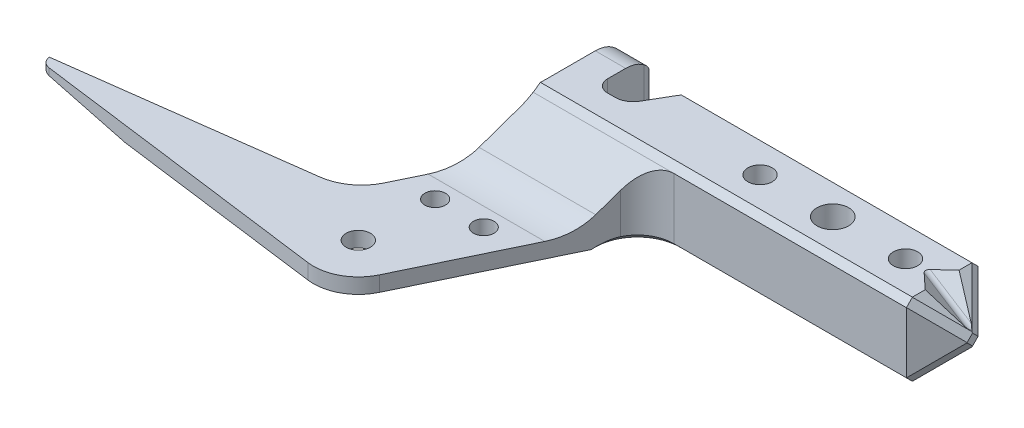
from build123d import *

# Parameters (mm, degrees)
BOSS_EXTRUDE1_DEPTH          = 2.5
BOSS_EXTRUDE2_DEPTH          = 12
F_4_0_4_DIAMETER_HOLE1_D     = 4
F_4_0_4_DIAMETER_HOLE2_D     = 4
F_5_2_5_2_DIAMETER_HOLE1_D   = 5.2
CHAMFER5_SIZE                = 8.5
FILLET13_R                   = 6
CHAMFER1_SIZE                = 5
CHAMFER2_SIZE                = 1
CHAMFER4_SIZE                = 0.8
CUT_REVOLVE1_ANGLE           = 60
CUT_REVOLVE1_OTHER_WAY_ANGLE = 60
FILLET4_R                    = 1
FILLET5_R                    = 8
FILLET6_R                    = 3
FILLET7_R                    = 2
FILLET11_R                   = 5
FILLET12_R                   = 2
CUT_EXTRUDE2_DEPTH           = 38
CHAMFER8_SIZE                = 6.868693549
CHAMFER8_SIZE_2              = 2.5
FILLET14_R                   = 3
M3_CLEARANCE_HOLE1_D         = 3.4


with BuildPart() as part:
    # Sketch1 → Boss-Extrude1 (new body)
    with BuildSketch(Plane(origin=(0, 0, 0), x_dir=(1, 0, 0), z_dir=(0, 1, 0))):
        with BuildLine():
            Line((-7.904447763, 6.416984589), (-51.546411114, 0.671411114))
            ThreePointArc((-51.546411114, 0.671411114), (-51.035673477, -0.364262362), (-50, -0.875))
            Line((-50, -0.875), (-0.965087675, -7.330568677))
            ThreePointArc((-0.965087675, -7.330568677), (3.516208172, -6.504222585), (6.661937904, -3.207368814))
            Line((6.661937904, -3.207368814), (21.2, 26.989241728))
            Line((21.2, 26.989241728), (2, 26.989241728))
            Line((2, 26.989241728), (-7.904447763, 6.416984589))
        make_face()
    extrude(amount=BOSS_EXTRUDE1_DEPTH)

    # Sketch1<6> → Boss-Extrude2 (add)
    with BuildSketch(Plane(origin=(0, 0, 0), x_dir=(1, 0, 0), z_dir=(0, 1, 0))):
        Polygon((2, 42), (2, 26.989241728), (68.2, 26.989241728), (68.2, 38.789241728), (15.919770539, 38.789241728), (12, 32), (7, 32), (7, 42), align=None)
    extrude(amount=BOSS_EXTRUDE2_DEPTH)

    # Ø4.0 (4) Diameter Hole1 (through all)
    with Locations(Plane(origin=(0, 0, 0), x_dir=(-1, 0, 0), z_dir=(0, -1, 0))):
        with Locations((-57.170705016, 32.889241728), (-33.229294984, 32.889241728)):
            Hole(F_4_0_4_DIAMETER_HOLE1_D / 2)

    # Ø4.0 (4) Diameter Hole2 (through all)
    with Locations(Plane(origin=(0, 0, 0), x_dir=(-1, 0, 0), z_dir=(0, -1, 0))):
        with Locations((0, 0)):
            Hole(F_4_0_4_DIAMETER_HOLE2_D / 2)

    # Ø5.2 (5.2) Diameter Hole1 (through all)
    with Locations(Plane(origin=(0, 0, 0), x_dir=(-1, 0, 0), z_dir=(0, -1, 0))):
        with Locations((-45.2, 32.889241728)):
            Hole(F_5_2_5_2_DIAMETER_HOLE1_D / 2)

    # Chamfer5
    chamfer5_edges = [part.edges().sort_by_distance(p)[0] for p in [
        (11.6, 2.5, -26.989241728),
    ]]
    chamfer(chamfer5_edges, length=CHAMFER5_SIZE)

    # Fillet13
    fillet13_edges = [part.edges().sort_by_distance(p)[0] for p in [
        (21.2, 5.5, -26.989241728),
    ]]
    fillet(fillet13_edges, radius=FILLET13_R)

    # Chamfer1
    chamfer1_edges = [part.edges().sort_by_distance(p)[0] for p in [
        (68.2, 0, -32.889241728),
        (68.2, 6, -26.989241728),
        (68.2, 6, -38.789241728),
        (68.2, 12, -32.889241728),
    ]]
    chamfer(chamfer1_edges, length=CHAMFER1_SIZE)

    # Chamfer2
    # the kernel refuses this chamfer: 1 mm, written as the material it takes off along each edge
    with BuildSketch(Plane(origin=(24.970484005, 0, -26.989241728), x_dir=(0, 0, -1), z_dir=(1, 0, 0))) as chamfer2_piece_1:
        Polygon((CHAMFER2_SIZE, 0), (0, CHAMFER2_SIZE), (0, 0), align=None)
    extrude(amount=40.801198983, mode=Mode.SUBTRACT)
    with BuildSketch(Plane(origin=(-0.571682988, 12, -26.989241728), x_dir=(0, -1, 0), z_dir=(1, 0, 0))) as chamfer2_piece_2:
        Polygon((CHAMFER2_SIZE, 0), (0, CHAMFER2_SIZE), (0, 0), align=None)
    extrude(amount=66.343365976, mode=Mode.SUBTRACT)
    with BuildSketch(Plane(origin=(65.771682988, 12, -38.789241728), x_dir=(0, -1, 0), z_dir=(-1, 0, 0)), Plane(origin=(65.771682988, 0, -38.789241728), x_dir=(0, 0, 1), z_dir=(-1, 0, 0))) as chamfer2_piece_3:
        Polygon((CHAMFER2_SIZE, 0), (0, CHAMFER2_SIZE), (0, 0), align=None)
    extrude(amount=52.423595437, mode=Mode.SUBTRACT)
    with BuildSketch(Plane(origin=(24.970484005, 0, -20.989241728), x_dir=(-0.9610284466527214, -1.1097335043339142e-15, 0.27644949760174536), z_dir=(0.27644949760174536, 0, 0.9610284466527214))) as chamfer2_piece_4:
        Polygon((6 + CHAMFER2_SIZE, 0), (6, -CHAMFER2_SIZE), (6, 0), align=None)
    revolve(axis=Axis((24.970484005, 0, -20.989241728), (0, -1, 0)), revolution_arc=106.048413393, mode=Mode.SUBTRACT)

    # Chamfer4
    # the kernel refuses this chamfer: 0.8 mm, written as the material it takes off along each edge
    with BuildSketch(Plane(origin=(62.505076275, -0.694923725, -39.484165453), x_dir=(-0.40824829046386635, -0.4082482904638597, 0.816496580927726), z_dir=(0.5773502691896258, 0.5773502691896258, 0.5773502691896258)), Plane(origin=(62.505076275, 12.694923725, -39.484165453), x_dir=(-0.40824829046386746, -0.816496580927726, -0.4082482904638586), z_dir=(0.5773502691896258, -0.5773502691896258, 0.5773502691896258)), Plane(origin=(69.394923725, 5.805076275, -33.184165453), x_dir=(-0.408248290463863, -0.816496580927726, 0.408248290463863), z_dir=(-0.5773502691896258, 0.5773502691896258, 0.5773502691896258))) as chamfer4_piece_1:
        Polygon((CHAMFER4_SIZE, 0), (-CHAMFER4_SIZE * 0.5, -CHAMFER4_SIZE * 0.866025403784), (0, 0), align=None)
    extrude(amount=11.933565841, mode=Mode.SUBTRACT)
    with BuildSketch(Plane(origin=(62.505076275, -0.694923725, -26.294318002), x_dir=(-0.4082482904638641, -0.4082482904638619, -0.816496580927726), z_dir=(0.5773502691896258, 0.5773502691896258, -0.5773502691896258))) as chamfer4_piece_2:
        Polygon((CHAMFER4_SIZE, 0), (-CHAMFER4_SIZE * 0.5, CHAMFER4_SIZE * 0.866025403784), (0, 0), align=None)
    extrude(amount=11.933565841, mode=Mode.SUBTRACT)

    # Sketch7 → Cut-Revolve1 (revolve, cut)
    with BuildSketch(Plane.XY.offset(-32.889241728)):
        Polygon((68.2, 6.920204103), (60.2, 12), (60.2, 14), (68.2, 14), align=None)
    revolve(axis=Axis((68.2, 6.920204103, -32.889241728), (-0.8441922430161829, 0.5360405365560577, 0)), revolution_arc=CUT_REVOLVE1_ANGLE, mode=Mode.SUBTRACT)

    # Sketch7 → Cut-Revolve1 other way (revolve, cut)
    with BuildSketch(Plane.XY.offset(-32.889241728)):
        Polygon((68.2, 6.920204103), (60.2, 12), (60.2, 14), (68.2, 14), align=None)
    revolve(axis=Axis((68.2, 6.920204103, -32.889241728), (0.8441922430161829, -0.5360405365560577, 0)), revolution_arc=CUT_REVOLVE1_OTHER_WAY_ANGLE, mode=Mode.SUBTRACT)

    # Fillet4
    # the kernel refuses this fillet: 1 mm, written as the material it adds along each edge
    with BuildSketch(Plane(origin=(69.418486547, 6.146496233, -32.889241728), x_dir=(0.26802026827802927, 0.42209612150809256, -0.8660254037844378), z_dir=(-0.8441922430161831, 0.5360405365560573, 0))) as fillet4_piece_1_section:
        with BuildLine():
            CenterArc((FILLET4_R * 0.57735026919, -FILLET4_R), FILLET4_R, 90, 60)
            Line((-FILLET4_R * 0.288675134595, -FILLET4_R * 0.5), (0, 0))
            Line((0, 0), (FILLET4_R * 0.57735026919, 0))
        make_face()
    fillet4_piece_1 = extrude(amount=12.363265808, mode=Mode.PRIVATE)
    fillet4_piece_1 = split(fillet4_piece_1, bisect_by=Plane(origin=(69.418486547, 12, -32.889241728), z_dir=(0, -1, 0)), keep=Keep.TOP, mode=Mode.PRIVATE)
    fillet4_piece_1 = split(fillet4_piece_1, bisect_by=Plane(origin=(68.864064806, 5.869285362, -33.166452598), z_dir=(-0.8164965809277263, -0.4082482904637079, -0.4082482904640183)), keep=Keep.TOP, mode=Mode.PRIVATE)
    fillet4_piece_1 = split(fillet4_piece_1, bisect_by=Plane(origin=(69.235995157, 5.964004843, -32.889241728), z_dir=(-0.7071067811865476, -0.7071067811865476, 0)), keep=Keep.TOP, mode=Mode.PRIVATE)
    fillet4_piece_1 = split(fillet4_piece_1, bisect_by=Plane(origin=(68.864064806, 5.869285362, -32.612030857), z_dir=(-0.8164965809277263, -0.4082482904637079, 0.4082482904640183)), keep=Keep.TOP, mode=Mode.PRIVATE)
    add(fillet4_piece_1)

    # Fillet5
    fillet5_edges = [part.edges().sort_by_distance(p)[0] for p in [
        (7.507702037, 2.5, -18.489241728),
        (-7.904447763, 1.25, -6.416984589),
        (2, 5.5, -26.989241728),
    ]]
    fillet(fillet5_edges, radius=FILLET5_R)

    # Fillet6
    fillet6_edges = [part.edges().sort_by_distance(p)[0] for p in [
        (15.919770539, 6, -38.789241728),
        (12, 6, -32),
    ]]
    fillet(fillet6_edges, radius=FILLET6_R)

    # Fillet7
    fillet7_edges = [part.edges().sort_by_distance(p)[0] for p in [
        (7, 6, -32),
    ]]
    fillet(fillet7_edges, radius=FILLET7_R)

    # Fillet11
    fillet11_edges = [part.edges().sort_by_distance(p)[0] for p in [
        (4.5, 0, -42),
        (4.5, 12, -42),
    ]]
    fillet(fillet11_edges, radius=FILLET11_R)

    # Fillet12
    # the kernel refuses this fillet: 2 mm, written as the material it takes off along each edge
    with BuildSketch(Plane(origin=(2, 0, -42), x_dir=(0, 0, 1), z_dir=(0, 1, 0))) as fillet12_piece_1:
        with BuildLine():
            CenterArc((FILLET12_R, FILLET12_R), FILLET12_R, 180, 90)
            Line((0, FILLET12_R), (0, 0))
            Line((0, 0), (FILLET12_R, 0))
        make_face()
    extrude(amount=12, mode=Mode.SUBTRACT)
    with BuildSketch(Plane(origin=(7, 0, -42), x_dir=(0, 0, 1), z_dir=(0, 1, 0))) as fillet12_piece_2:
        with BuildLine():
            CenterArc((FILLET12_R, -FILLET12_R), FILLET12_R, 90, 90)
            Line((0, -FILLET12_R), (0, 0))
            Line((0, 0), (FILLET12_R, 0))
        make_face()
    extrude(amount=12, mode=Mode.SUBTRACT)

    # Sketch11 → Cut-Extrude2 (cut)
    with BuildSketch(Plane(origin=(-50.581323439, 0, 6.659157562), x_dir=(0, -1, 0), z_dir=(0.9914448613738103, 0, -0.1305261922200527))):
        Polygon((-2, 7.393823865), (0, 1.898869026), (0, 7.393823865), align=None)
    extrude(amount=CUT_EXTRUDE2_DEPTH, mode=Mode.SUBTRACT)

    # Chamfer8
    # the kernel refuses this chamfer: 6.868693549, 2.5 mm, written as the material it takes off along each edge
    with BuildSketch(Plane(origin=(-10.828460053, 0, 17.48282525), x_dir=(0.9914448613738103, 0, -0.1305261922200527), z_dir=(-0.1305261922200527, 0, -0.9914448613738103))) as chamfer8_piece_1_section:
        Polygon((CHAMFER8_SIZE, 0), (0, -CHAMFER8_SIZE_2), (0, 0), align=None)
    chamfer8_piece_1 = extrude(amount=41.132412086, mode=Mode.PRIVATE)
    chamfer8_piece_1 = split(chamfer8_piece_1, bisect_by=Plane(origin=(-11.100528233, -5.72682899, 15.416262251), z_dir=(-0.04464258697085675, -0.939692620785907, -0.3390941135865724)), keep=Keep.TOP, mode=Mode.PRIVATE)
    add(chamfer8_piece_1, mode=Mode.SUBTRACT)

    # Fillet14
    fillet14_edges = [part.edges().sort_by_distance(p)[0] for p in [
        (-9.426930062, 1, -3.445360698),
    ]]
    fillet(fillet14_edges, radius=FILLET14_R)

    # M3 Clearance Hole1 (through all)
    with Locations(Plane(origin=(0, 2.5, 0), x_dir=(1, 0, 0), z_dir=(0, 1, 0))):
        with Locations((0.467987162, 12.175533229), (8.467987162, 12.175533229)):
            Hole(M3_CLEARANCE_HOLE1_D / 2)


solid = part.part
